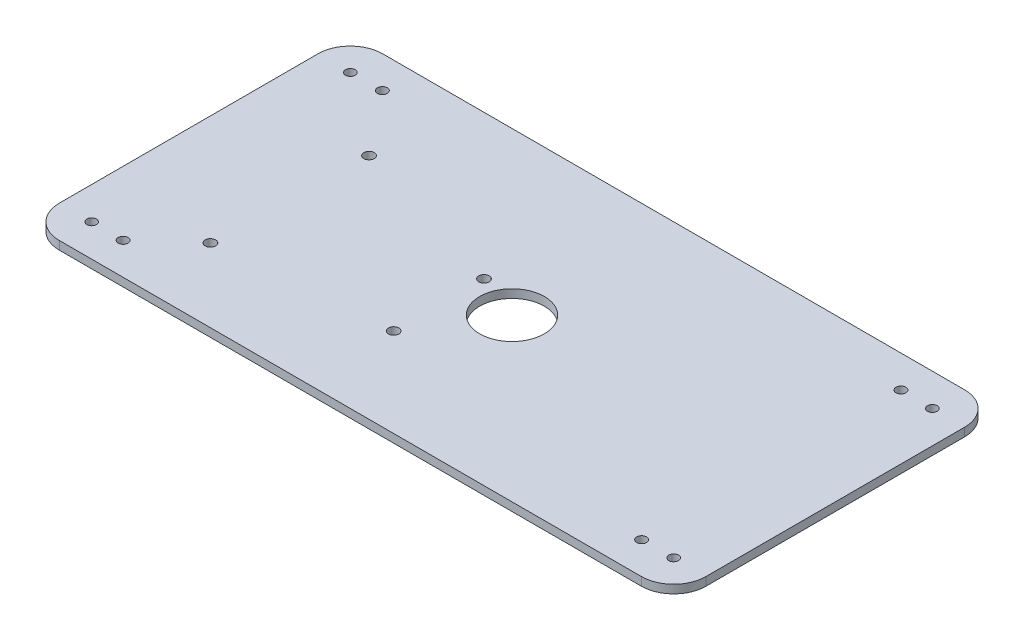
from build123d import *

# Parameters (mm, degrees)
SKETCH1_W               = 200
SKETCH1_H               = 100
BOSS_EXTRUDE1_DEPTH     = 2.6
FILLET1_R               = 10
SKETCH6_R               = 1.5
CUT_EXTRUDE6_DEPTH      = 2.6
MIRROR6_COPY_1_SKETCH_R = 1.5
MIRROR6_COPY_1_DEPTH    = 2.6
MIRROR6_COPY_2_SKETCH_R = 1.5
MIRROR6_COPY_2_DEPTH    = 2.6
SKETCH16_R              = 1.61925
CUT_EXTRUDE9_DEPTH      = 10
SKETCH17_R              = 1.61925
CUT_EXTRUDE10_DEPTH     = 224.621913059
SKETCH18_R              = 1.61925
CUT_EXTRUDE11_DEPTH     = 224.621913059
SKETCH19_R              = 1.61925
CUT_EXTRUDE12_DEPTH     = 224.621913059
SKETCH15_R              = 10
CUT_EXTRUDE14_DEPTH     = 224.621913059
SKETCH23_R              = 1.524
CUT_EXTRUDE15_DEPTH     = 2.59999988
MIRROR8_COPY_1_SKETCH_R = 1.524
MIRROR8_COPY_1_DEPTH    = 2.59999988
MIRROR8_COPY_2_SKETCH_R = 1.524
MIRROR8_COPY_2_DEPTH    = 2.59999988


with BuildPart() as part:
    # Sketch1 → Boss-Extrude1 (new body)
    with BuildSketch(Plane(origin=(0, 0, 0), x_dir=(1, 0, 0), z_dir=(0, 1, 0))):
        with Locations((100, -50)):
            Rectangle(SKETCH1_W, SKETCH1_H)
    extrude(amount=BOSS_EXTRUDE1_DEPTH)

    # Fillet1
    fillet1_edges = [part.edges().sort_by_distance(p)[0] for p in [
        (0, 1.3, 0),
        (0, 1.3, 100),
        (200, 1.3, 100),
        (200, 1.3, 0),
    ]]
    fillet(fillet1_edges, radius=FILLET1_R)

    # Sketch6 → Cut-Extrude6 (cut)
    with BuildSketch(Plane.XZ):
        with Locations((190, 10)):
            Circle(SKETCH6_R)
    cut_extrude6 = extrude(amount=-CUT_EXTRUDE6_DEPTH, mode=Mode.SUBTRACT)

    # Mirror5: Cut-Extrude6 across plane
    add(cut_extrude6.mirror(Plane(origin=(100, 0, 0), x_dir=(0, 0, 1), z_dir=(1, 0, 0))), mode=Mode.SUBTRACT)

    # Mirror6 copy 1 sketch → Mirror6 copy 1 (cut)
    with BuildSketch(Plane(origin=(200, 0, 100), x_dir=(-1, 0, 0), z_dir=(0, -1, 0))):
        with Locations((190, 10)):
            Circle(MIRROR6_COPY_1_SKETCH_R)
    extrude(amount=-MIRROR6_COPY_1_DEPTH, mode=Mode.SUBTRACT)

    # Mirror6 copy 2 sketch → Mirror6 copy 2 (cut)
    with BuildSketch(Plane(origin=(0, 0, 100), x_dir=(1, 0, 0), z_dir=(0, -1, 0))):
        with Locations((190, -10)):
            Circle(MIRROR6_COPY_2_SKETCH_R)
    extrude(amount=-MIRROR6_COPY_2_DEPTH, mode=Mode.SUBTRACT)

    # Sketch16 → Cut-Extrude9 (cut)
    with BuildSketch(Plane(origin=(0, 2.6, 0), x_dir=(1, 0, 0), z_dir=(0, 1, 0))):
        with Locations((35.15745, -29.37145)):
            Circle(SKETCH16_R)
    extrude(amount=-CUT_EXTRUDE9_DEPTH, mode=Mode.SUBTRACT)

    # Sketch17 → Cut-Extrude10 (cut, through all)
    with BuildSketch(Plane(origin=(0, 2.6, 0), x_dir=(1, 0, 0), z_dir=(0, 1, 0))):
        with Locations((85.94475, -44.61145)):
            Circle(SKETCH17_R)
    extrude(amount=-CUT_EXTRUDE10_DEPTH, mode=Mode.SUBTRACT)

    # Sketch18 → Cut-Extrude11 (cut, through all)
    with BuildSketch(Plane(origin=(0, 2.6, 0), x_dir=(1, 0, 0), z_dir=(0, 1, 0))):
        with Locations((34.01445, -77.28855)):
            Circle(SKETCH18_R)
    extrude(amount=-CUT_EXTRUDE11_DEPTH, mode=Mode.SUBTRACT)

    # Sketch19 → Cut-Extrude12 (cut, through all)
    with BuildSketch(Plane(origin=(0, 2.6, 0), x_dir=(1, 0, 0), z_dir=(0, 1, 0))):
        with Locations((85.94475, -72.53875)):
            Circle(SKETCH19_R)
    extrude(amount=-CUT_EXTRUDE12_DEPTH, mode=Mode.SUBTRACT)

    # Sketch15 → Cut-Extrude14 (cut, through all)
    with BuildSketch(Plane.XZ):
        with Locations((100, 50)):
            Circle(SKETCH15_R)
    extrude(amount=-CUT_EXTRUDE14_DEPTH, mode=Mode.SUBTRACT)

    # Sketch23 → Cut-Extrude15 (cut)
    with BuildSketch(Plane(origin=(0, 2.6, 0), x_dir=(1, 0, 0), z_dir=(0, 1, 0))):
        with Locations((19.812, -9.906)):
            Circle(SKETCH23_R)
    cut_extrude15 = extrude(amount=-CUT_EXTRUDE15_DEPTH, mode=Mode.SUBTRACT)

    # Mirror7: Cut-Extrude15 across plane
    add(cut_extrude15.mirror(Plane(origin=(100, 0, 0), x_dir=(0, 0, 1), z_dir=(1, 0, 0))), mode=Mode.SUBTRACT)

    # Mirror8 copy 1 sketch → Mirror8 copy 1 (cut)
    with BuildSketch(Plane(origin=(200, 2.6, 100), x_dir=(-1, 0, 0), z_dir=(0, 1, 0))):
        with Locations((19.812, -9.906)):
            Circle(MIRROR8_COPY_1_SKETCH_R)
    extrude(amount=-MIRROR8_COPY_1_DEPTH, mode=Mode.SUBTRACT)

    # Mirror8 copy 2 sketch → Mirror8 copy 2 (cut)
    with BuildSketch(Plane(origin=(0, 2.6, 100), x_dir=(1, 0, 0), z_dir=(0, 1, 0))):
        with Locations((19.812, 9.906)):
            Circle(MIRROR8_COPY_2_SKETCH_R)
    extrude(amount=-MIRROR8_COPY_2_DEPTH, mode=Mode.SUBTRACT)


solid = part.part
